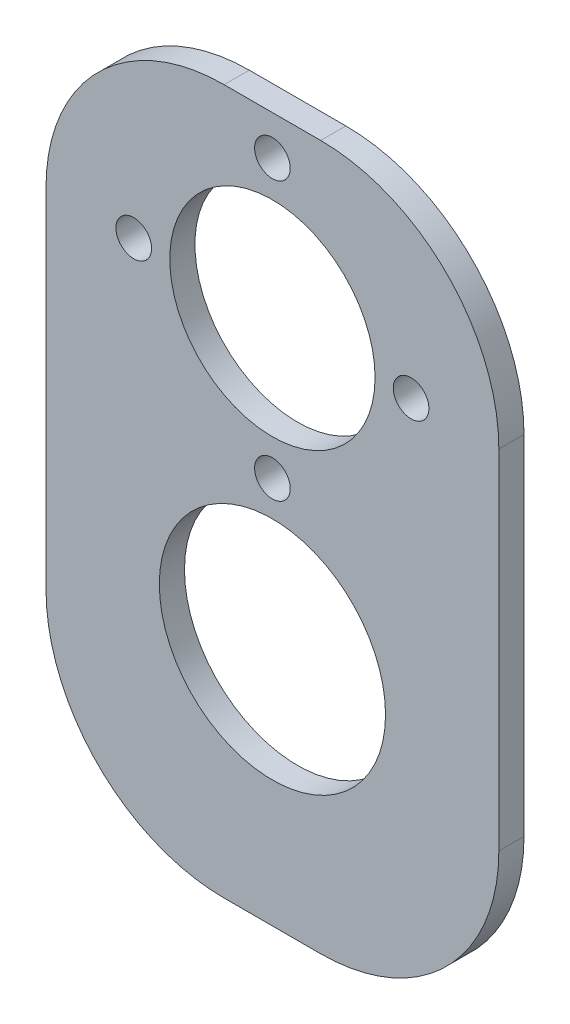
from build123d import *

# Parameters (mm, degrees)
SKETCH1_W           = 57.15
SKETCH1_H           = 88.9
SKETCH1_R           = 14.2748
SKETCH1_R_2         = 2.25
SKETCH1_R_3         = 12.954
BOSS_EXTRUDE1_DEPTH = 3.175
FILLET1_R           = 22.479


with BuildPart() as part:
    # Sketch1 → Boss-Extrude1 (new body)
    with BuildSketch(Plane.XY):
        with Locations((0, 10.014175534)):
            Rectangle(SKETCH1_W, SKETCH1_H)
        with Locations((0, -4.209824466)):
            Circle(SKETCH1_R, mode=Mode.SUBTRACT)
        with Locations((-17.5006, 31.985175534)):
            Circle(SKETCH1_R_2, mode=Mode.SUBTRACT)
        with Locations((0, 14.484575534)):
            Circle(SKETCH1_R_2, mode=Mode.SUBTRACT)
        with Locations((0, 31.985175534)):
            Circle(SKETCH1_R_3, mode=Mode.SUBTRACT)
        with Locations((17.5006, 31.985175534)):
            Circle(SKETCH1_R_2, mode=Mode.SUBTRACT)
        with Locations((0, 49.485775534)):
            Circle(SKETCH1_R_2, mode=Mode.SUBTRACT)
    extrude(amount=BOSS_EXTRUDE1_DEPTH)

    # Fillet1
    fillet1_edges = [part.edges().sort_by_distance(p)[0] for p in [
        (28.575, -34.435824466, 1.5875),
        (-28.575, -34.435824466, 1.5875),
        (28.575, 54.464175534, 1.5875),
        (-28.575, 54.464175534, 1.5875),
    ]]
    fillet(fillet1_edges, radius=FILLET1_R)


solid = part.part
